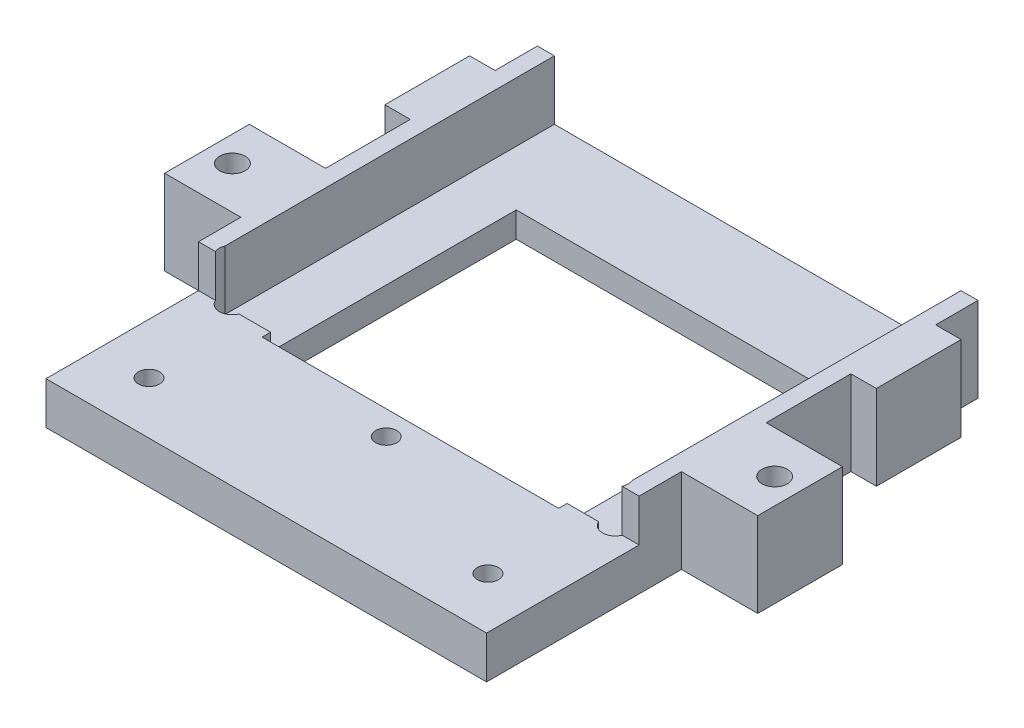
from build123d import *

# Parameters (mm, degrees)
SKETCH1_W               = 52
SKETCH1_H               = 60
BOSS_EXTRUDE1_DEPTH     = 10
CUT_EXTRUDE1_DEPTH      = 5
SKETCH3_R               = 1.25
CUT_EXTRUDE2_DEPTH      = 5
CUT_EXTRUDE3_DEPTH      = 3
SKETCH6_W               = 35
SKETCH6_H               = 30
CUT_EXTRUDE4_DEPTH      = 41.938978981
SKETCH7_W               = 3
SKETCH7_H               = 10
BOSS_EXTRUDE2_DEPTH     = 10
LPATTERN1_COUNT         = 2
LPATTERN1_PITCH         = 20
MIRROR1_COPY_1_SKETCH_W = 3
MIRROR1_COPY_1_SKETCH_H = 10
MIRROR1_COPY_1_DEPTH    = 10
MIRROR1_COPY_2_SKETCH_W = 3
MIRROR1_COPY_2_SKETCH_H = 10
MIRROR1_COPY_2_DEPTH    = 10
SKETCH8_W               = 48
SKETCH8_H               = 40
CUT_EXTRUDE5_DEPTH      = 2
SKETCH10_R              = 1.5
CUT_EXTRUDE7_DEPTH      = 7
SKETCH11_W              = 52
SKETCH11_H              = 2
CUT_EXTRUDE8_DEPTH      = 10
SKETCH12_W              = 6
SKETCH12_H              = 10
SKETCH12_R              = 1.5
BOSS_EXTRUDE3_DEPTH     = 10


with BuildPart() as part:
    # Sketch1 → Boss-Extrude1 (new body)
    with BuildSketch(Plane(origin=(0, 0, 0), x_dir=(1, 0, 0), z_dir=(0, 1, 0))):
        Rectangle(SKETCH1_W, SKETCH1_H)
    extrude(amount=BOSS_EXTRUDE1_DEPTH)

    # Sketch2 → Cut-Extrude1 (cut)
    with BuildSketch(Plane(origin=(0, 10, 0), x_dir=(1, 0, 0), z_dir=(0, 1, 0))):
        Polygon((-26, -30), (26, -30), (26, -10), (24, -10), (24, 30), (-24, 30), (-24, -10), (-26, -10), align=None)
    extrude(amount=-CUT_EXTRUDE1_DEPTH, mode=Mode.SUBTRACT)

    # Sketch3 → Cut-Extrude2 (cut)
    with BuildSketch(Plane(origin=(0, 5, 0), x_dir=(1, 0, 0), z_dir=(0, 1, 0))):
        with Locations((-20, -21.847557332)):
            Circle(SKETCH3_R)
        with Locations((0, -13.847557332)):
            Circle(SKETCH3_R)
        with Locations((20, -21.847557332)):
            Circle(SKETCH3_R)
    extrude(amount=-CUT_EXTRUDE2_DEPTH, mode=Mode.SUBTRACT)

    # Sketch5 → Cut-Extrude3 (cut)
    with BuildSketch(Plane.XZ):
        Polygon((-18.375, 24.662139894), (-21.625, 24.662139894), (-23.25, 21.847557332), (-21.625, 19.03297477), (-18.375, 19.03297477), (-16.75, 21.847557332), align=None)
        Polygon((1.625, 16.662139894), (-1.625, 16.662139894), (-3.25, 13.847557332), (-1.625, 11.03297477), (1.625, 11.03297477), (3.25, 13.847557332), align=None)
        Polygon((21.625, 24.662139894), (18.375, 24.662139894), (16.75, 21.847557332), (18.375, 19.03297477), (21.625, 19.03297477), (23.25, 21.847557332), align=None)
    extrude(amount=-CUT_EXTRUDE3_DEPTH, mode=Mode.SUBTRACT)

    # Sketch6 → Cut-Extrude4 (cut, through all)
    with BuildSketch(Plane.XZ):
        with Locations((0, -4)):
            Rectangle(SKETCH6_W, SKETCH6_H)
    extrude(amount=-CUT_EXTRUDE4_DEPTH, mode=Mode.SUBTRACT)

    # Sketch7 → Boss-Extrude2 (add)
    with BuildSketch(Plane(origin=(0, 10, 0), x_dir=(1, 0, 0), z_dir=(0, 1, 0))):
        with Locations((-27.5, 20)):
            Rectangle(SKETCH7_W, SKETCH7_H)
    boss_extrude2 = extrude(amount=-BOSS_EXTRUDE2_DEPTH)

    # LPattern1: Boss-Extrude2 ×2
    with Locations(*[(0, 0, i * LPATTERN1_PITCH) for i in range(1, LPATTERN1_COUNT)]):
        add(boss_extrude2)

    # Mirror1 copy 1 sketch → Mirror1 copy 1 (add)
    with BuildSketch(Plane(origin=(0, 10, 20), x_dir=(-1, 0, 0), z_dir=(0, 1, 0))):
        with Locations((-27.5, -20)):
            Rectangle(MIRROR1_COPY_1_SKETCH_W, MIRROR1_COPY_1_SKETCH_H)
    extrude(amount=-MIRROR1_COPY_1_DEPTH)

    # Mirror1 copy 2 sketch → Mirror1 copy 2 (add)
    with BuildSketch(Plane(origin=(0, 10, 0), x_dir=(-1, 0, 0), z_dir=(0, 1, 0))):
        with Locations((-27.5, -20)):
            Rectangle(MIRROR1_COPY_2_SKETCH_W, MIRROR1_COPY_2_SKETCH_H)
    extrude(amount=-MIRROR1_COPY_2_DEPTH)

    # Sketch8 → Cut-Extrude5 (cut)
    with BuildSketch(Plane(origin=(0, 5, 0), x_dir=(1, 0, 0), z_dir=(0, 1, 0))):
        with Locations((0, 10)):
            Rectangle(SKETCH8_W, SKETCH8_H)
    extrude(amount=-CUT_EXTRUDE5_DEPTH, mode=Mode.SUBTRACT)

    # Sketch10 → Cut-Extrude7 (cut)
    with BuildSketch(Plane(origin=(0, 10, 0), x_dir=(1, 0, 0), z_dir=(0, 1, 0))):
        with Locations((22.615384615, -9.423076923)):
            Circle(SKETCH10_R)
        with Locations((-22.615384615, -9.423076923)):
            Circle(SKETCH10_R)
    extrude(amount=-CUT_EXTRUDE7_DEPTH, mode=Mode.SUBTRACT)

    # Sketch11 → Cut-Extrude8 (cut)
    with BuildSketch(Plane.XZ):
        with Locations((0, 29)):
            Rectangle(SKETCH11_W, SKETCH11_H)
    extrude(amount=-CUT_EXTRUDE8_DEPTH, mode=Mode.SUBTRACT)

    # Sketch12 → Boss-Extrude3 (add)
    with BuildSketch(Plane.XZ):
        with Locations((-32, 0)):
            Rectangle(SKETCH12_W, SKETCH12_H)
        with Locations((-32, 0)):
            Circle(SKETCH12_R, mode=Mode.SUBTRACT)
    boss_extrude3 = extrude(amount=-BOSS_EXTRUDE3_DEPTH)

    # Mirror2: Boss-Extrude3 across plane
    add(boss_extrude3.mirror(Plane(origin=(0, 0, 0), x_dir=(0, 0, 1), z_dir=(1, 0, 0))))


solid = part.part
